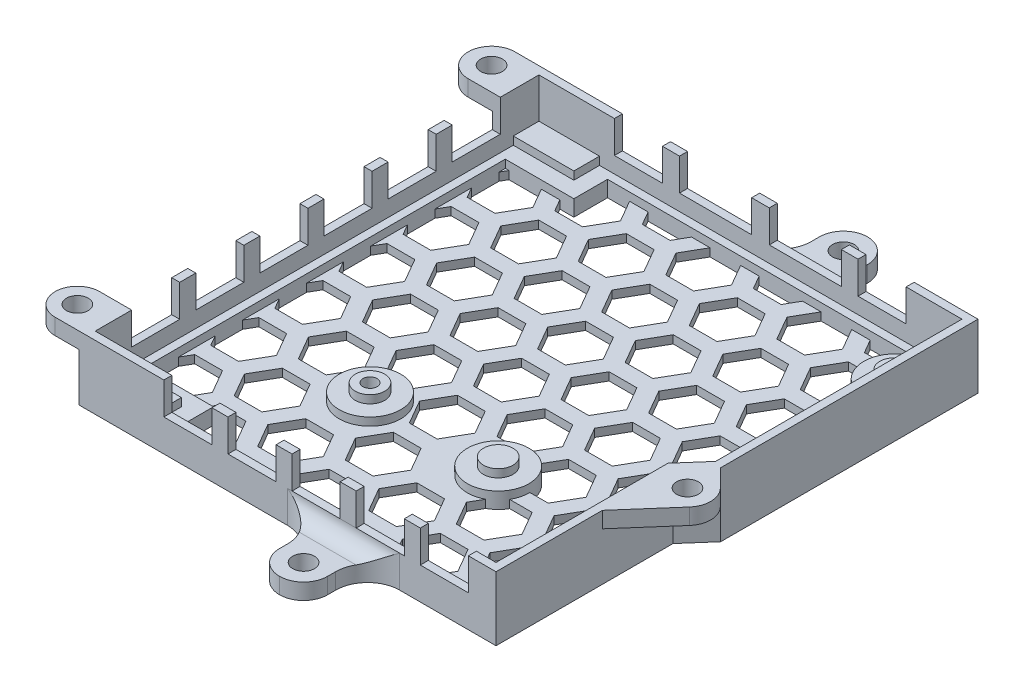
from build123d import *

# Parameters (mm, degrees)
BOSS_EXTRUDE1_DEPTH                  = 12.7
CUT_EXTRUDE1_DEPTH                   = 11.1125
SKETCH3_R                            = 2.921
SKETCH3_W                            = 12
SKETCH3_H                            = 5.08
BOSS_EXTRUDE2_DEPTH                  = 3.175
SKETCH5_R                            = 1.4
CUT_EXTRUDE2_DEPTH                   = 122.706618592
SKETCH6_W                            = 9.525
SKETCH6_H                            = 5.462005323
CUT_EXTRUDE3_DEPTH                   = 6.35
LPATTERN1_COUNT                      = 5
LPATTERN1_PITCH                      = 12.7
SKETCH7_W                            = 9.544273655
SKETCH7_H                            = 9.525
CUT_EXTRUDE4_DEPTH                   = 6.35
LPATTERN2_COUNT                      = 6
LPATTERN2_PITCH                      = 12.7
SKETCH8_W                            = 9.525
SKETCH8_H                            = 4.470021121
SKETCH8_W_2                          = 14.2875
CUT_EXTRUDE5_DEPTH                   = 6.35
BOSS_EXTRUDE3_DEPTH                  = 3.175
SKETCH14_W                           = 2.15265
SKETCH14_H                           = 3.175
FILLET1_R                            = 4.7625
BOSS_EXTRUDE5_REACH                  = 114.025
BOSS_EXTRUDE5_END_RADIUS             = 6.35
BOSS_EXTRUDE5_DIRECTION_2_REACH      = 114.025
BOSS_EXTRUDE5_DIRECTION_2_END_RADIUS = 6.35
BOSS_EXTRUDE6_REACH                  = 114.025
BOSS_EXTRUDE6_END_RADIUS             = 6.35
BOSS_EXTRUDE6_DIRECTION_2_REACH      = 114.025
BOSS_EXTRUDE6_DIRECTION_2_END_RADIUS = 6.35
FILL_PATTERN4_DEPTH                  = 1.5875
BOSS_EXTRUDE7_DEPTH                  = 3.175
F_6_CLEARANCE_HOLE3_D                = 4.3053
SKETCH27_R                           = 2.921
SKETCH27_R_2                         = 6.096
BOSS_EXTRUDE10_DEPTH                 = 3.175


# Read off the part's stored shape, not the designer's step: Fill Pattern4
with BuildPart() as part:
    # Sketch1 → Boss-Extrude1 (new body)
    with BuildSketch(Plane(origin=(0, 0, 0), x_dir=(1, 0, 0), z_dir=(0, 1, 0))):
        Polygon((-3.175, 87.8992), (-3.175, -3.175), (79.3953, -3.175), (79.3953, 31.877838461), (83.8047, 36.917138461), (83.8047, 87.8992), align=None)
    extrude(amount=BOSS_EXTRUDE1_DEPTH)

    # Sketch2 → Cut-Extrude1 (cut)
    with BuildSketch(Plane(origin=(0, 12.7, 0), x_dir=(1, 0, 0), z_dir=(0, 1, 0))):
        Polygon((82.2172, 86.3117), (-1.5875, 86.3117), (-1.5875, -1.5875), (77.8078, -1.5875), (77.8078, 32.474319231), (82.2172, 37.513619231), align=None)
    extrude(amount=-CUT_EXTRUDE1_DEPTH, mode=Mode.SUBTRACT)

    # Sketch3 → Boss-Extrude2 (add)
    with BuildSketch(Plane(origin=(0, 1.5875, 0), x_dir=(1, 0, 0), z_dir=(0, 1, 0))):
        with Locations(Location((26.5354, 24.7243, 0), (0, 0, 270))):
            Circle(SKETCH3_R)
        with Locations(Location((76.299, 78.8975, 0), (0, 0, 270))):
            Circle(SKETCH3_R)
        with Locations(Location((51.9354, 24.7243, 0), (0, 0, 270))):
            Circle(SKETCH3_R)
        with Locations((4.4125, 0.9525)):
            Rectangle(SKETCH3_W, SKETCH3_H)
        with Locations((4.4125, 83.7717)):
            Rectangle(SKETCH3_W, SKETCH3_H)
    extrude(amount=BOSS_EXTRUDE2_DEPTH)

    # Sketch5 → Cut-Extrude2 (cut, through all)
    with BuildSketch(Plane(origin=(0, 4.7625, 0), x_dir=(1, 0, 0), z_dir=(0, 1, 0))):
        with Locations(Location((26.5354, 24.7243, 0), (0, 0, 270))):
            Circle(SKETCH5_R)
        with Locations(Location((76.299, 78.8975, 0), (0, 0, 270))):
            Circle(SKETCH5_R)
    extrude(amount=-CUT_EXTRUDE2_DEPTH, mode=Mode.SUBTRACT)

    # Sketch6 → Cut-Extrude3 (cut)
    with BuildSketch(Plane(origin=(0, 12.7, 0), x_dir=(1, 0, 0), z_dir=(0, 1, 0))):
        with Locations((18.3597, -3.462844721)):
            Rectangle(SKETCH6_W, SKETCH6_H)
    cut_extrude3 = extrude(amount=-CUT_EXTRUDE3_DEPTH, mode=Mode.SUBTRACT)

    # LPattern1: Cut-Extrude3 ×5
    with Locations(*[(i * LPATTERN1_PITCH, 0, 0) for i in range(1, LPATTERN1_COUNT)]):
        add(cut_extrude3, mode=Mode.SUBTRACT)

    # Sketch7 → Cut-Extrude4 (cut)
    with BuildSketch(Plane(origin=(0, 12.7, 0), x_dir=(1, 0, 0), z_dir=(0, 1, 0))):
        with Locations((-3.818106275, 10.393)):
            Rectangle(SKETCH7_W, SKETCH7_H)
    cut_extrude4 = extrude(amount=-CUT_EXTRUDE4_DEPTH, mode=Mode.SUBTRACT)

    # LPattern2: Cut-Extrude4 ×6
    with Locations(*[(0, 0, -i * LPATTERN2_PITCH) for i in range(1, LPATTERN2_COUNT)]):
        add(cut_extrude4, mode=Mode.SUBTRACT)

    # Sketch8 → Cut-Extrude5 (cut)
    with BuildSketch(Plane(origin=(0, 12.7, 0), x_dir=(1, 0, 0), z_dir=(0, 1, 0))):
        with Locations((18.1248, 87.894362279)):
            Rectangle(SKETCH8_W, SKETCH8_H)
        with Locations((33.4048, 87.894362279)):
            Rectangle(SKETCH8_W_2, SKETCH8_H)
        with Locations((51.1848, 87.894362279)):
            Rectangle(SKETCH8_W_2, SKETCH8_H)
        with Locations((66.3848, 87.894362279)):
            Rectangle(SKETCH8_W, SKETCH8_H)
    extrude(amount=-CUT_EXTRUDE5_DEPTH, mode=Mode.SUBTRACT)



with BuildPart() as body_2:
    # Sketch12 → Boss-Extrude3 (new body)
    with BuildSketch(Plane.XZ):
        with BuildLine():
            Line((38.1, -87.8992), (60.325, -87.8992))
            ThreePointArc((60.325, -87.8992), (55.834871939, -89.759071939), (53.975, -94.2492))
            Line((53.975, -94.2492), (53.975, -100.5992))
            Line((53.975, -100.5992), (44.45, -100.5992))
            Line((44.45, -100.5992), (44.45, -94.2492))
            ThreePointArc((44.45, -94.2492), (42.590128061, -89.759071939), (38.1, -87.8992))
        make_face()
    extrude(amount=-BOSS_EXTRUDE3_DEPTH)

    # Sketch14 → #6 Clearance Hole2 (revolve, cut)
    with BuildSketch(Plane(origin=(49.2125, 3.175, -95.8367), x_dir=(0, 0, 1), z_dir=(1, 0, 0))):
        with Locations((1.076325, 1.5875)):
            Rectangle(SKETCH14_W, SKETCH14_H)
    revolve(axis=Axis((49.2125, 9.525, -95.8367), (0, -1, 0)), mode=Mode.SUBTRACT)

    # Fillet1
    fillet1_edges = [body_2.edges().sort_by_distance(p)[0] for p in [
        (53.975, 1.5875, -100.5992),
        (44.45, 1.5875, -100.5992),
    ]]
    fillet(fillet1_edges, radius=FILLET1_R - 0.0001)  # a hair under: the kernel refuses the full size


with BuildPart() as body_3:
    # Mirror8: mirrored copy
    add(body_2.part.mirror(Plane.XY.offset(-42.3621)))


with BuildPart() as part_1:
    add(part.part)

    add(body_2.part)  # Boss-Extrude5 merges body 2
    # Boss-Extrude5: up to this cylinder (the profile starts outside it)
    boss_extrude5_end = Plane(origin=(60.325, 3.884193, -94.2492), z_dir=(0, -1, 0)) * Cylinder(BOSS_EXTRUDE5_END_RADIUS, 241.75, mode=Mode.PRIVATE)
    # Sketch16 → Boss-Extrude5 (add, up to the surface)
    with BuildSketch(Plane.ZY.offset(-44.45), mode=Mode.PRIVATE) as boss_extrude5_sk1:
        with BuildLine():
            Line((-87.8992, 6.35), (-87.8992, 3.175))
            Line((-87.8992, 3.175), (-91.0742, 3.175))
            ThreePointArc((-91.0742, 3.175), (-88.82913597, 4.10493597), (-87.8992, 6.35))
        make_face()
    boss_extrude5_tool1 = extrude(boss_extrude5_sk1.sketch, amount=-BOSS_EXTRUDE5_REACH, mode=Mode.PRIVATE) - boss_extrude5_end
    add(boss_extrude5_tool1.solids().sort_by_distance((44.45, 3.884193, -88.608393))[0])

    # Boss-Extrude5 direction 2: up to this cylinder (the profile starts outside it)
    boss_extrude5_direction_2_end = Plane(origin=(38.1, 3.884193, -94.2492), z_dir=(0, -1, 0)) * Cylinder(BOSS_EXTRUDE5_DIRECTION_2_END_RADIUS, 241.75, mode=Mode.PRIVATE)
    # Sketch16 → Boss-Extrude5 direction 2 (add, up to the surface)
    with BuildSketch(Plane.ZY.offset(-44.45), mode=Mode.PRIVATE) as boss_extrude5_direction_2_sk1:
        with BuildLine():
            Line((-87.8992, 6.35), (-87.8992, 3.175))
            Line((-87.8992, 3.175), (-91.0742, 3.175))
            ThreePointArc((-91.0742, 3.175), (-88.82913597, 4.10493597), (-87.8992, 6.35))
        make_face()
    boss_extrude5_direction_2_tool1 = extrude(boss_extrude5_direction_2_sk1.sketch, amount=BOSS_EXTRUDE5_DIRECTION_2_REACH, mode=Mode.PRIVATE) - boss_extrude5_direction_2_end
    add(boss_extrude5_direction_2_tool1.solids().sort_by_distance((44.45, 3.884193, -88.608393))[0])


    add(body_3.part)  # Boss-Extrude6 merges body 3
    # Boss-Extrude6: up to this cylinder (the profile starts outside it)
    boss_extrude6_end = Plane(origin=(60.325, 3.884193, 9.525), z_dir=(0, -1, 0)) * Cylinder(BOSS_EXTRUDE6_END_RADIUS, 241.75, mode=Mode.PRIVATE)
    # Sketch18 → Boss-Extrude6 (add, up to the surface)
    with BuildSketch(Plane.ZY.offset(-44.45), mode=Mode.PRIVATE) as boss_extrude6_sk1:
        with BuildLine():
            Line((3.175, 3.175), (6.35, 3.175))
            ThreePointArc((6.35, 3.175), (4.10493597, 4.10493597), (3.175, 6.35))
            Line((3.175, 6.35), (3.175, 3.175))
        make_face()
    boss_extrude6_tool1 = extrude(boss_extrude6_sk1.sketch, amount=-BOSS_EXTRUDE6_REACH, mode=Mode.PRIVATE) - boss_extrude6_end
    add(boss_extrude6_tool1.solids().sort_by_distance((44.45, 3.884193, 3.884193))[0])

    # Boss-Extrude6 direction 2: up to this cylinder (the profile starts outside it)
    boss_extrude6_direction_2_end = Plane(origin=(38.1, 3.884193, 9.525), z_dir=(0, -1, 0)) * Cylinder(BOSS_EXTRUDE6_DIRECTION_2_END_RADIUS, 241.75, mode=Mode.PRIVATE)
    # Sketch18 → Boss-Extrude6 direction 2 (add, up to the surface)
    with BuildSketch(Plane.ZY.offset(-44.45), mode=Mode.PRIVATE) as boss_extrude6_direction_2_sk1:
        with BuildLine():
            Line((3.175, 3.175), (6.35, 3.175))
            ThreePointArc((6.35, 3.175), (4.10493597, 4.10493597), (3.175, 6.35))
            Line((3.175, 6.35), (3.175, 3.175))
        make_face()
    boss_extrude6_direction_2_tool1 = extrude(boss_extrude6_direction_2_sk1.sketch, amount=BOSS_EXTRUDE6_DIRECTION_2_REACH, mode=Mode.PRIVATE) - boss_extrude6_direction_2_end
    add(boss_extrude6_direction_2_tool1.solids().sort_by_distance((44.45, 3.884193, 3.884193))[0])

    # Fill Pattern4 outline → Fill Pattern4 (cut)
    with BuildSketch(Plane(origin=(0, 0, 0), x_dir=(1, 0, 0), z_dir=(0, 1, 0))):
        Polygon((9.434080524, 80.439151555), (12.183711181, 75.676651555), (17.682972495, 75.676651555), (20.432603152, 80.439151555), (17.682972495, 85.201651555), (12.183711181, 85.201651555), align=None)
        Polygon((20.432603152, 61.389151555), (23.182233809, 56.626651555), (28.681495123, 56.626651555), (31.43112578, 61.389151555), (28.681495123, 66.151651555), (23.182233809, 66.151651555), align=None)
        Polygon((31.43112578, 42.339151555), (34.180756437, 37.576651555), (39.680017751, 37.576651555), (42.429648408, 42.339151555), (39.680017751, 47.101651555), (34.180756437, 47.101651555), align=None)
        Polygon((53.428171036, 4.239151555), (56.177801693, -0.523348445), (61.677063007, -0.523348445), (64.426693664, 4.239151555), (61.677063007, 9.001651555), (56.177801693, 9.001651555), align=None)
        Polygon((56.177801693, 75.676651555), (61.677063007, 75.676651555), (64.426693664, 80.439151555), (61.677063007, 85.201651555), (56.177801693, 85.201651555), (53.428171036, 80.439151555), align=None)
        Polygon((34.180756437, 75.676651555), (39.680017751, 75.676651555), (42.429648408, 80.439151555), (39.680017751, 85.201651555), (34.180756437, 85.201651555), (31.43112578, 80.439151555), align=None)
        Polygon((6.684449866, 56.626651555), (9.434080524, 61.389151555), (6.684449866, 66.151651555), (1.185188552, 66.151651555), (-1.564442105, 61.389151555), (1.185188552, 56.626651555), align=None)
        Polygon((9.434080524, 4.239151555), (12.183711181, -0.523348445), (17.682972495, -0.523348445), (20.432603152, 4.239151555), (17.682972495, 9.001651555), (12.183711181, 9.001651555), align=None)
        Polygon((-1.564442105, 23.289151555), (1.185188552, 18.526651555), (6.684449866, 18.526651555), (9.434080524, 23.289151555), (6.684449866, 28.051651555), (1.185188552, 28.051651555), align=None)
        Polygon((34.180756437, -0.523348445), (39.680017751, -0.523348445), (42.429648408, 4.239151555), (39.680017751, 9.001651555), (34.180756437, 9.001651555), (31.43112578, 4.239151555), align=None)
        Polygon((50.678540379, 56.626651555), (53.428171036, 61.389151555), (50.678540379, 66.151651555), (45.179279065, 66.151651555), (42.429648408, 61.389151555), (45.179279065, 56.626651555), align=None)
        Polygon((75.425216292, 86.789151555), (74.784329524, 87.8992), (65.067580432, 87.8992), (64.426693664, 86.789151555), (67.176324321, 82.026651555), (72.675585635, 82.026651555), align=None)
        Polygon((83.674108263, 62.976651555), (83.8047, 63.202843079), (83.8047, 72.275460032), (83.674108263, 72.501651555), (78.174846949, 72.501651555), (75.425216292, 67.739151555), (78.174846949, 62.976651555), align=None)
        Polygon((83.674108263, 50.276651555), (83.8047, 50.502843079), (83.8047, 59.575460032), (83.674108263, 59.801651555), (78.174846949, 59.801651555), (75.425216292, 55.039151555), (78.174846949, 50.276651555), align=None)
        Polygon((75.425216292, 42.339151555), (78.174846949, 37.576651555), (83.674108263, 37.576651555), (83.8047, 37.802843079), (83.8047, 46.875460032), (83.674108263, 47.101651555), (78.174846949, 47.101651555), align=None)
        Polygon((64.426693664, 61.389151555), (67.176324321, 56.626651555), (72.675585635, 56.626651555), (75.425216292, 61.389151555), (72.675585635, 66.151651555), (67.176324321, 66.151651555), align=None)
        Polygon((12.183711181, 37.576651555), (17.682972495, 37.576651555), (20.432603152, 42.339151555), (17.682972495, 47.101651555), (12.183711181, 47.101651555), (9.434080524, 42.339151555), align=None)
        Polygon((56.177801693, 37.576651555), (61.677063007, 37.576651555), (64.426693664, 42.339151555), (61.677063007, 47.101651555), (56.177801693, 47.101651555), (53.428171036, 42.339151555), align=None)
        Polygon((72.675585635, 18.526651555), (75.425216292, 23.289151555), (72.675585635, 28.051651555), (67.176324321, 28.051651555), (64.426693664, 23.289151555), (67.176324321, 18.526651555), align=None)
        Polygon((64.426693664, 74.089151555), (67.176324321, 69.326651555), (72.675585635, 69.326651555), (75.425216292, 74.089151555), (72.675585635, 78.851651555), (67.176324321, 78.851651555), align=None)
        Polygon((12.183711181, 50.276651555), (17.682972495, 50.276651555), (20.432603152, 55.039151555), (17.682972495, 59.801651555), (12.183711181, 59.801651555), (9.434080524, 55.039151555), align=None)
        Polygon((34.180756437, 50.276651555), (39.680017751, 50.276651555), (42.429648408, 55.039151555), (39.680017751, 59.801651555), (34.180756437, 59.801651555), (31.43112578, 55.039151555), align=None)
        Polygon((56.177801693, 50.276651555), (61.677063007, 50.276651555), (64.426693664, 55.039151555), (61.677063007, 59.801651555), (56.177801693, 59.801651555), (53.428171036, 55.039151555), align=None)
        Polygon((72.675585635, 31.226651555), (75.425216292, 35.989151555), (72.675585635, 40.751651555), (67.176324321, 40.751651555), (64.426693664, 35.989151555), (67.176324321, 31.226651555), align=None)
        Polygon((50.678540379, -6.873348445), (53.428171036, -2.110848445), (50.678540379, 2.651651555), (45.179279065, 2.651651555), (42.429648408, -2.110848445), (45.179279065, -6.873348445), align=None)
        Polygon((61.677063007, 12.176651555), (64.426693664, 16.939151555), (61.677063007, 21.701651555), (56.177801693, 21.701651555), (53.428171036, 16.939151555), (56.177801693, 12.176651555), align=None)
        Polygon((56.177801693, 62.976651555), (61.677063007, 62.976651555), (64.426693664, 67.739151555), (61.677063007, 72.501651555), (56.177801693, 72.501651555), (53.428171036, 67.739151555), align=None)
        Polygon((12.183711181, 62.976651555), (17.682972495, 62.976651555), (20.432603152, 67.739151555), (17.682972495, 72.501651555), (12.183711181, 72.501651555), (9.434080524, 67.739151555), align=None)
        Polygon((34.180756437, 62.976651555), (39.680017751, 62.976651555), (42.429648408, 67.739151555), (39.680017751, 72.501651555), (34.180756437, 72.501651555), (31.43112578, 67.739151555), align=None)
        Polygon((72.675585635, 43.926651555), (75.425216292, 48.689151555), (72.675585635, 53.451651555), (67.176324321, 53.451651555), (64.426693664, 48.689151555), (67.176324321, 43.926651555), align=None)
        Polygon((50.678540379, 5.826651555), (53.428171036, 10.589151555), (50.678540379, 15.351651555), (45.179279065, 15.351651555), (42.429648408, 10.589151555), (45.179279065, 5.826651555), align=None)
        Polygon((61.677063007, 24.876651555), (64.426693664, 29.639151555), (61.677063007, 34.401651555), (56.177801693, 34.401651555), (53.428171036, 29.639151555), (56.177801693, 24.876651555), align=None)
        Polygon((20.432603152, 86.789151555), (23.182233809, 82.026651555), (28.681495123, 82.026651555), (31.43112578, 86.789151555), (30.790239011, 87.8992), (21.07348992, 87.8992), align=None)
        Polygon((64.426693664, 10.589151555), (67.176324321, 5.826651555), (72.675585635, 5.826651555), (75.425216292, 10.589151555), (72.675585635, 15.351651555), (67.176324321, 15.351651555), align=None)
        Polygon((42.429648408, 48.689151555), (45.179279065, 43.926651555), (50.678540379, 43.926651555), (53.428171036, 48.689151555), (50.678540379, 53.451651555), (45.179279065, 53.451651555), align=None)
        Polygon((45.179279065, 82.026651555), (50.678540379, 82.026651555), (53.428171036, 86.789151555), (50.678540379, 91.551651555), (45.179279065, 91.551651555), (42.429648408, 86.789151555), align=None)
        Polygon((6.684449866, 43.926651555), (9.434080524, 48.689151555), (6.684449866, 53.451651555), (1.185188552, 53.451651555), (-1.564442105, 48.689151555), (1.185188552, 43.926651555), align=None)
        Polygon((20.432603152, 35.989151555), (23.182233809, 31.226651555), (28.681495123, 31.226651555), (31.43112578, 35.989151555), (28.681495123, 40.751651555), (23.182233809, 40.751651555), align=None)
        Polygon((31.43112578, 16.939151555), (34.180756437, 12.176651555), (39.680017751, 12.176651555), (42.429648408, 16.939151555), (39.680017751, 21.701651555), (34.180756437, 21.701651555), align=None)
        Polygon((-1.564442105, 74.089151555), (1.185188552, 69.326651555), (6.684449866, 69.326651555), (9.434080524, 74.089151555), (6.684449866, 78.851651555), (1.185188552, 78.851651555), align=None)
        Polygon((1.185188552, 31.226651555), (6.684449866, 31.226651555), (9.434080524, 35.989151555), (6.684449866, 40.751651555), (1.185188552, 40.751651555), (-1.564442105, 35.989151555), align=None)
        Polygon((45.179279065, 31.226651555), (50.678540379, 31.226651555), (53.428171036, 35.989151555), (50.678540379, 40.751651555), (45.179279065, 40.751651555), (42.429648408, 35.989151555), align=None)
        Polygon((17.682972495, 12.176651555), (20.432603152, 16.939151555), (17.682972495, 21.701651555), (12.183711181, 21.701651555), (9.434080524, 16.939151555), (12.183711181, 12.176651555), align=None)
        Polygon((50.678540379, 69.326651555), (53.428171036, 74.089151555), (50.678540379, 78.851651555), (45.179279065, 78.851651555), (42.429648408, 74.089151555), (45.179279065, 69.326651555), align=None)
        Polygon((28.681495123, 69.326651555), (31.43112578, 74.089151555), (28.681495123, 78.851651555), (23.182233809, 78.851651555), (20.432603152, 74.089151555), (23.182233809, 69.326651555), align=None)
        Polygon((20.432603152, -2.110848445), (21.046991339, -3.175), (30.816737593, -3.175), (31.43112578, -2.110848445), (28.681495123, 2.651651555), (23.182233809, 2.651651555), align=None)
        Polygon((72.675585635, 2.651651555), (67.176324321, 2.651651555), (64.426693664, -2.110848445), (65.041081851, -3.175), (74.810828105, -3.175), (75.425216292, -2.110848445), align=None)
        Polygon((9.434080524, 29.639151555), (12.183711181, 24.876651555), (17.682972495, 24.876651555), (20.432603152, 29.639151555), (17.682972495, 34.401651555), (12.183711181, 34.401651555), align=None)
        Polygon((20.432603152, 10.589151555), (23.182233809, 5.826651555), (28.681495123, 5.826651555), (31.43112578, 10.589151555), (28.681495123, 15.351651555), (23.182233809, 15.351651555), align=None)
        Polygon((34.180756437, 24.876651555), (39.680017751, 24.876651555), (42.429648408, 29.639151555), (39.680017751, 34.401651555), (34.180756437, 34.401651555), (31.43112578, 29.639151555), align=None)
        Polygon((28.681495123, 43.926651555), (31.43112578, 48.689151555), (28.681495123, 53.451651555), (23.182233809, 53.451651555), (20.432603152, 48.689151555), (23.182233809, 43.926651555), align=None)
        Polygon((6.684449866, 5.826651555), (9.434080524, 10.589151555), (6.684449866, 15.351651555), (1.185188552, 15.351651555), (-1.564442105, 10.589151555), (1.185188552, 5.826651555), align=None)
    extrude(amount=FILL_PATTERN4_DEPTH, mode=Mode.SUBTRACT)

    # Sketch22 → Boss-Extrude7 (add)
    with BuildSketch(Plane(origin=(0, 12.7, 0), x_dir=(1, 0, 0), z_dir=(0, 1, 0))):
        with BuildLine():
            Line((83.8047, 36.917138461), (87.28407409, 33.373432701))
            ThreePointArc((87.28407409, 33.373432701), (88.600903638, 30.280169774), (87.463720699, 27.116448774))
            Line((87.463720699, 27.116448774), (79.3953, 17.895422687))
            Line((79.3953, 17.895422687), (79.3953, 31.877838461))
            Line((79.3953, 31.877838461), (83.8047, 36.917138461))
        make_face()
        with BuildLine():
            Line((-3.175, 78.6555), (-7.9375, 78.6555))
            ThreePointArc((-7.9375, 78.6555), (-12.55935, 83.27735), (-7.9375, 87.8992))
            Line((-7.9375, 87.8992), (-3.175, 87.8992))
            Line((-3.175, 87.8992), (-3.175, 78.6555))
        make_face()
        with BuildLine():
            Line((-3.175, 5.6305), (-7.9375, 5.6305))
            ThreePointArc((-7.9375, 5.6305), (-12.34025, 1.22775), (-7.9375, -3.175))
            Line((-7.9375, -3.175), (-3.175, -3.175))
            Line((-3.175, -3.175), (-3.175, 5.6305))
        make_face()
    extrude(amount=-BOSS_EXTRUDE7_DEPTH)

    # #6 Clearance Hole3 (through all)
    with Locations(Plane(origin=(0, 12.7, 0), x_dir=(1, 0, 0), z_dir=(0, 1, 0))):
        with Locations((83.99905, 30.14804423), (-7.9375, 83.27735), (-7.9375, 1.22775)):
            Hole(F_6_CLEARANCE_HOLE3_D / 2)

    # Sketch27 → Boss-Extrude10 (add)
    # profile 1 of 3: a face of its own
    with BuildSketch(Plane(origin=(0, 0, 0), x_dir=(1, 0, 0), z_dir=(0, 1, 0))):
        Polygon((-3.175, 3.4925), (-3.175, 81.2317), (10.4125, 81.2317), (10.4125, 87.8992), (83.8047, 87.8992), (83.8047, 36.917138461), (79.3953, 31.877838461), (79.3953, -3.175), (10.4125, -3.175), (10.4125, 3.4925), align=None)
        with Locations(Location((76.299, 78.8975, 0), (0, 0, 90))):
            Circle(SKETCH27_R, mode=Mode.SUBTRACT)
        with BuildLine():
            ThreePointArc((74.507134182, 84.7242), (71.083676994, 75.741296277), (80.6297, 74.607249016))
            Line((80.6297, 74.607249016), (80.6297, 38.1101))
            Line((80.6297, 38.1101), (76.2203, 33.0708))
            Line((76.2203, 33.0708), (76.2203, 0))
            Line((76.2203, 0), (13.5875, 0))
            Line((13.5875, 0), (13.5875, 6.6675))
            Line((13.5875, 6.6675), (0, 6.6675))
            Line((0, 6.6675), (0, 78.0567))
            Line((0, 78.0567), (13.5875, 78.0567))
            Line((13.5875, 78.0567), (13.5875, 84.7242))
            Line((13.5875, 84.7242), (74.507134182, 84.7242))
        make_face(mode=Mode.SUBTRACT)
    # profile 2 of 3: a face of its own
    with BuildSketch(Plane(origin=(0, 0, 0), x_dir=(1, 0, 0), z_dir=(0, 1, 0))):
        with Locations(Location((51.9354, 24.7243, 0), (0, 0, 90))):
            Circle(SKETCH27_R_2)
        with Locations(Location((51.9354, 24.7243, 0), (0, 0, 90))):
            Circle(SKETCH27_R, mode=Mode.SUBTRACT)
    # profile 3 of 3: a face of its own
    with BuildSketch(Plane(origin=(0, 0, 0), x_dir=(1, 0, 0), z_dir=(0, 1, 0))):
        with Locations(Location((26.5354, 24.7243, 0), (0, 0, 90))):
            Circle(SKETCH27_R_2)
        with Locations(Location((26.5354, 24.7243, 0), (0, 0, 90))):
            Circle(SKETCH27_R, mode=Mode.SUBTRACT)
    extrude(amount=BOSS_EXTRUDE10_DEPTH)


solid = part_1.part
